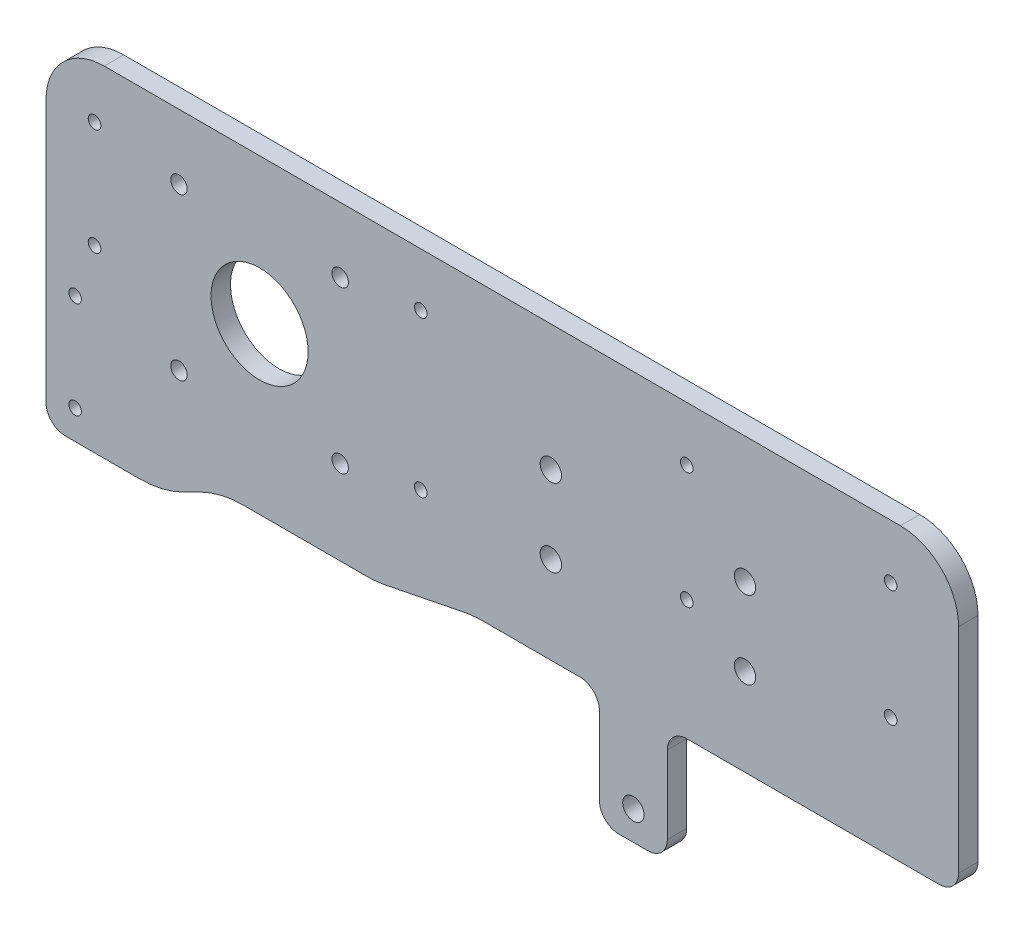
from build123d import *

# Parameters (mm, degrees)
TABAN_FLAN_1_DEPTH    = 10
IZIM2_R               = 25
IZIM2_R_2             = 4.25
IZIM2_R_3             = 5.5
IZIM2_R_4             = 3.25
KES_EKSTR_ZYON1_DEPTH = 10
RADYUS3_R             = 30
RADYUS4_R             = 10
RADYUS5_R             = 50
IZIM3_R               = 3.25
KES_EKSTR_ZYON2_DEPTH = 10
RADYUS7_R             = 10
RADYUS8_R             = 30


# Sheet-metal steps are written as plain solids
with BuildPart() as part:
    # Çizim1 → Taban-Flanş1 (new body)
    with BuildSketch(Plane.XY):
        Polygon((0, 120), (-470, 120), (-470, -55), (-410, -55), (-380, -40), (-300, -40), (-250, -30), (-185, -30), (-185, -90), (-150, -90), (-150, -30), (0, -30), (0, 0), align=None)
    extrude(amount=-TABAN_FLAN_1_DEPTH)

    # Çizim2 → Kes-Ekstrüzyon1 (cut)
    with BuildSketch(Plane.XY):
        with Locations((-360, 45)):
            Circle(IZIM2_R)
        with Locations((-401.5, 86.5)):
            Circle(IZIM2_R_2)
        with Locations((-318.5, 86.5)):
            Circle(IZIM2_R_2)
        with Locations((-401.5, 3.5)):
            Circle(IZIM2_R_2)
        with Locations((-318.5, 3.5)):
            Circle(IZIM2_R_2)
        with Locations((-110, 55)):
            Circle(IZIM2_R_3)
        with Locations((-210, 55)):
            Circle(IZIM2_R_3)
        with Locations((-210, 15)):
            Circle(IZIM2_R_3)
        with Locations((-110, 15)):
            Circle(IZIM2_R_3)
        with Locations((-167.5, -75)):
            Circle(IZIM2_R_3)
        with Locations((-455, 10)):
            Circle(IZIM2_R_4)
        with Locations((-455, -40)):
            Circle(IZIM2_R_4)
    extrude(amount=-KES_EKSTR_ZYON1_DEPTH, mode=Mode.SUBTRACT)

    # Radyus3
    radyus3_edges = [part.edges().sort_by_distance(p)[0] for p in [
        (0, 120, -5),
    ]]
    fillet(radyus3_edges, radius=RADYUS3_R)

    # Radyus4
    radyus4_edges = [part.edges().sort_by_distance(p)[0] for p in [
        (0, -30, -5),
        (-150, -30, -5),
        (-150, -90, -5),
        (-185, -90, -5),
        (-185, -30, -5),
    ]]
    fillet(radyus4_edges, radius=RADYUS4_R)

    # Radyus5
    radyus5_edges = [part.edges().sort_by_distance(p)[0] for p in [
        (-250, -30, -5),
        (-300, -40, -5),
        (-380, -40, -5),
        (-410, -55, -5),
    ]]
    fillet(radyus5_edges, radius=RADYUS5_R)

    # Çizim3 → Kes-Ekstrüzyon2 (cut)
    with BuildSketch(Plane(origin=(0, 0, -10), x_dir=(-1, 0, 0), z_dir=(0, 0, -1))):
        with Locations((277, 92.5)):
            Circle(IZIM3_R)
        with Locations((277, 12.5)):
            Circle(IZIM3_R)
        with Locations((445, 37.5)):
            Circle(IZIM3_R)
        with Locations((445, 92.5)):
            Circle(IZIM3_R)
        with Locations((140, 92)):
            Circle(IZIM3_R)
        with Locations((35, 92)):
            Circle(IZIM3_R)
        with Locations((35, 32)):
            Circle(IZIM3_R)
        with Locations((140, 32)):
            Circle(IZIM3_R)
    extrude(amount=-KES_EKSTR_ZYON2_DEPTH, mode=Mode.SUBTRACT)

    # Radyus7
    radyus7_edges = [part.edges().sort_by_distance(p)[0] for p in [
        (-470, -55, -5),
    ]]
    fillet(radyus7_edges, radius=RADYUS7_R)

    # Radyus8
    radyus8_edges = [part.edges().sort_by_distance(p)[0] for p in [
        (-470, 120, -5),
    ]]
    fillet(radyus8_edges, radius=RADYUS8_R)


solid = part.part
